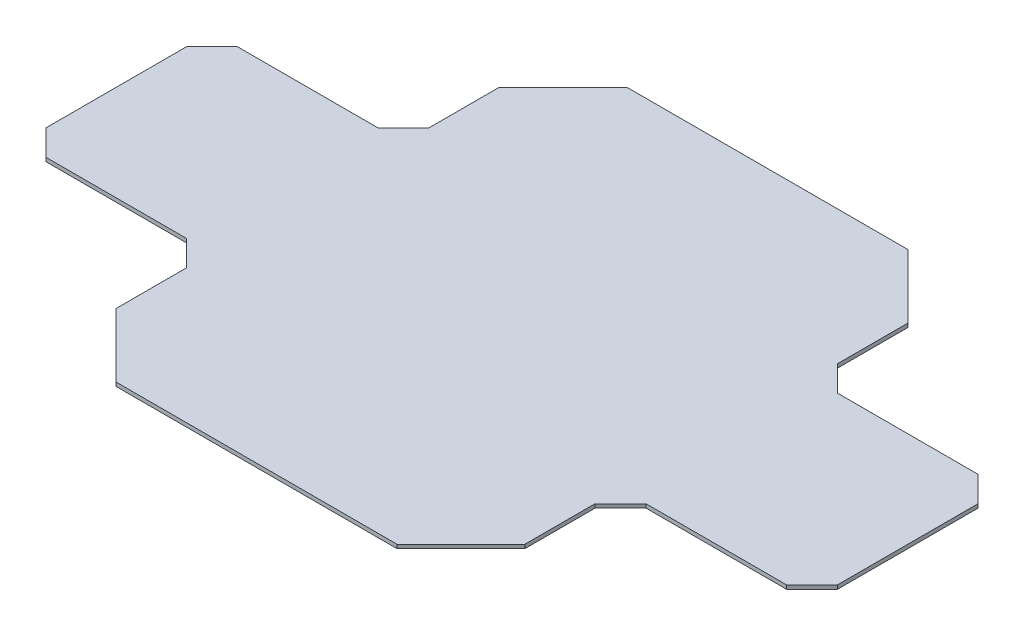
from build123d import *

# Parameters (mm, degrees)
EXTRUDE_1_DEPTH = 3
CHAMFER_1_SIZE  = 20
CHAMFER_2_SIZE  = 50


with BuildPart() as part:
    # 草图1 → 凸台-拉伸1 (new body)
    with BuildSketch(Plane(origin=(0, 0, 0), x_dir=(1, 0, 0), z_dir=(0, 1, 0))):
        Polygon((-310, -75), (-160, -75), (-160, -200), (160, -200), (160, -75), (310, -75), (310, 75), (160, 75), (160, 200), (-160, 200), (-160, 75), (-310, 75), align=None)
    extrude(amount=EXTRUDE_1_DEPTH)

    # 倒角1
    chamfer_1_edges = [part.edges().sort_by_distance(p)[0] for p in [
        (-160, 1.5, -75),
        (-310, 1.5, -75),
        (-310, 1.5, 75),
        (-160, 1.5, 75),
        (160, 1.5, 75),
        (160, 1.5, -75),
        (310, 1.5, 75),
        (310, 1.5, -75),
    ]]
    chamfer(chamfer_1_edges, length=CHAMFER_1_SIZE)

    # 倒角2
    chamfer_2_edges = [part.edges().sort_by_distance(p)[0] for p in [
        (160, 1.5, 200),
        (-160, 1.5, 200),
        (160, 1.5, -200),
        (-160, 1.5, -200),
    ]]
    chamfer(chamfer_2_edges, length=CHAMFER_2_SIZE)


solid = part.part
